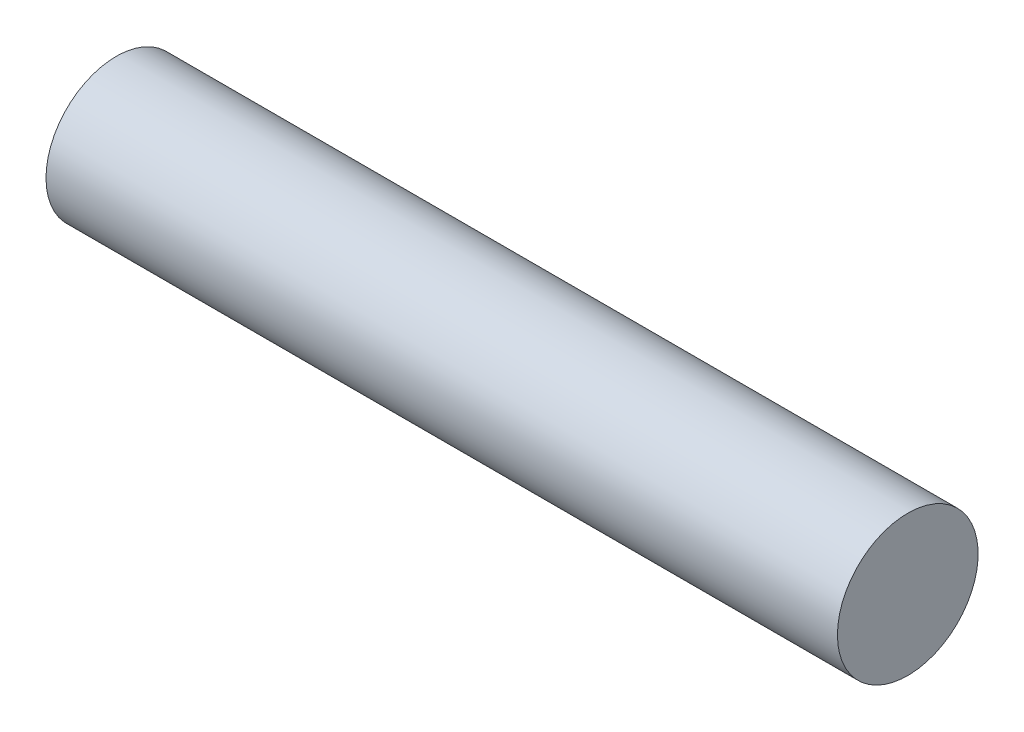
from build123d import *

# Parameters (mm, degrees)
SKETCH1_W = 45
SKETCH1_H = 4


with BuildPart() as part:
    # Sketch1 → Revolve1 (revolve)
    with BuildSketch(Plane.XY):
        with Locations((22.5, 2)):
            Rectangle(SKETCH1_W, SKETCH1_H)
    revolve(axis=Axis((-20.222222222, 0, 0), (1, 0, 0)))


solid = part.part
